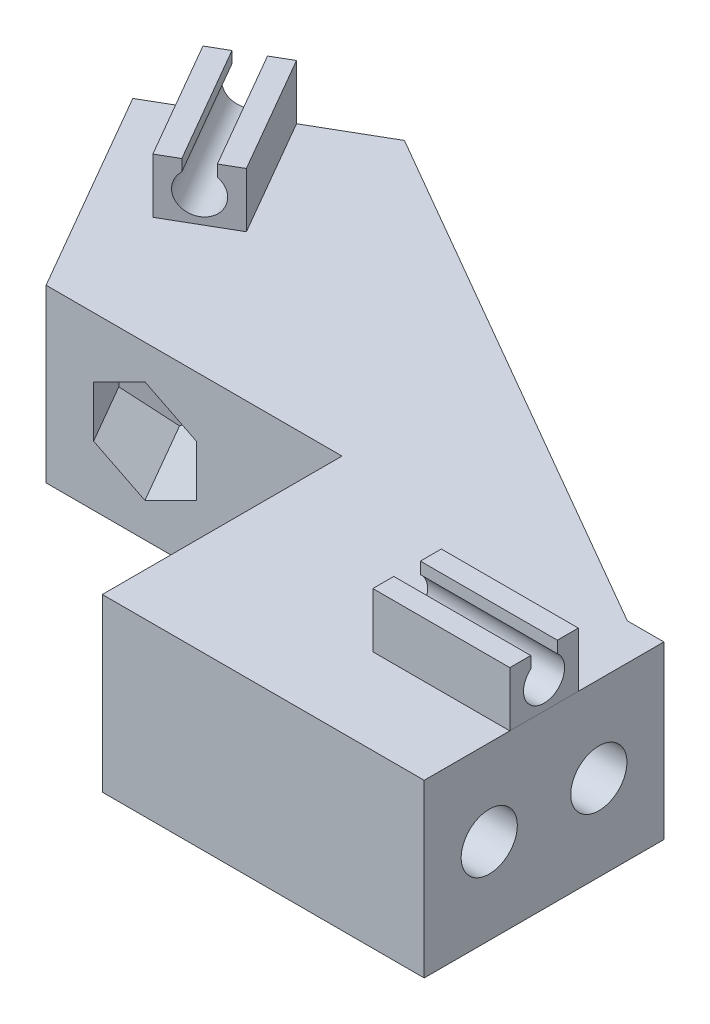
from build123d import *

# Parameters (mm, degrees)
BOSS_EXTRUDE1_DEPTH = 25
SKETCH2_R           = 4.1
CUT_EXTRUDE1_DEPTH  = 132.176713612
SKETCH3_R           = 4.1
CUT_EXTRUDE2_DEPTH  = 126.40868204
CUT_EXTRUDE4_START  = -28
CUT_EXTRUDE4_DEPTH  = 98.40868204
CHAMFER1_SIZE       = 56
CUT_EXTRUDE5_DEPTH  = 103.163428306
BOSS_EXTRUDE2_DEPTH = 20
BOSS_EXTRUDE3_DEPTH = 20


with BuildPart() as part:
    # Sketch1 → Boss-Extrude1 (new body)
    with BuildSketch(Plane(origin=(0, 0, 0), x_dir=(1, 0, 0), z_dir=(0, 1, 0))):
        Polygon((-40.444096004, 58.394853086), (-2.944096004, -6.557052198), (67.055903996, -6.557052198), (67.055903996, 28.442947802), (5.716158034, 28.442947802), (-18.793460909, 70.894853086), align=None)
    extrude(amount=BOSS_EXTRUDE1_DEPTH)

    # Sketch2 → Cut-Extrude1 (cut, through all)
    with BuildSketch(Plane(origin=(67.055903996, 0, 0), x_dir=(0, 0, -1), z_dir=(1, 0, 0))):
        with Locations((2.942947802, 12.5)):
            Circle(SKETCH2_R)
        with Locations((18.942947802, 12.5)):
            Circle(SKETCH2_R)
    extrude(amount=-CUT_EXTRUDE1_DEPTH, mode=Mode.SUBTRACT)

    # Sketch3 → Cut-Extrude2 (cut, through all)
    with BuildSketch(Plane(origin=(-35.396737112, 0, -61.3089471), x_dir=(-0.8660254037844396, 0, 0.4999999999999984), z_dir=(-0.49999999999999833, 0, -0.8660254037844395))):
        with Locations((-6.671811971, 12.5)):
            Circle(SKETCH3_R)
    extrude(amount=-CUT_EXTRUDE2_DEPTH, mode=Mode.SUBTRACT)

    # Sketch5 → Cut-Extrude4 (cut, through all)
    with BuildSketch(Plane(origin=(-35.396737112, 0, -61.3089471), x_dir=(-0.8660254037844397, 0, 0.4999999999999983), z_dir=(-0.4999999999999982, 0, -0.8660254037844396)).offset(CUT_EXTRUDE4_START)):
        Polygon((-13.167002499, 16.25), (-13.167002499, 8.75), (-6.671811971, 5), (-0.176621442, 8.75), (-0.176621442, 16.25), (-6.671811971, 20), align=None)
    extrude(amount=-CUT_EXTRUDE4_DEPTH, mode=Mode.SUBTRACT)

    # Chamfer1
    # the kernel refuses this chamfer: 56 mm, written as the material it adds along each edge
    with BuildSketch(Plane(origin=(5.716158034, 0, -28.442947802), x_dir=(-0.5166440803046883, 0, -0.8562002652920185), z_dir=(0, 1, 0))) as chamfer1_piece_1_section:
        Polygon((CHAMFER1_SIZE * 0.999813220622, -CHAMFER1_SIZE * 0.0193267656127), (-CHAMFER1_SIZE * 0.516644080305, -CHAMFER1_SIZE * 0.856200265292), (0, 0), align=None)
    chamfer1_piece_1 = extrude(amount=25, mode=Mode.PRIVATE)
    chamfer1_piece_1 = split(chamfer1_piece_1, bisect_by=Plane(origin=(-4.727526646, 12.5, -79.015824019), z_dir=(0.49999999999999756, 0, 0.86602540378444)), keep=Keep.TOP, mode=Mode.PRIVATE)
    add(chamfer1_piece_1)

    # Sketch6 → Cut-Extrude5 (cut, through all)
    with BuildSketch(Plane.XZ):
        Polygon((20.055903996, 6.557052198), (20.055903996, -28.442947802), (-23.151355425, -28.442947802), (-2.944096004, 6.557052198), align=None)
    extrude(amount=-CUT_EXTRUDE5_DEPTH, mode=Mode.SUBTRACT)

    # Sketch7 → Boss-Extrude2 (add)
    with BuildSketch(Plane(origin=(-35.396737112, 0, -61.3089471), x_dir=(-0.86602540378444, 0, 0.49999999999999784), z_dir=(-0.49999999999999784, 0, -0.86602540378444))):
        with BuildLine():
            Line((-1.671811971, 33), (-1.671811971, 25))
            Line((-1.671811971, 25), (-11.671811971, 25))
            Line((-11.671811971, 25), (-11.671811971, 33))
            Line((-11.671811971, 33), (-8.571811971, 33))
            Line((-8.571811971, 33), (-8.571811971, 31.321637353))
            ThreePointArc((-8.571811971, 31.321637353), (-6.671811971, 26), (-4.771811971, 31.321637353))
            Line((-4.771811971, 31.321637353), (-4.771811971, 33))
            Line((-4.771811971, 33), (-1.671811971, 33))
        make_face()
    extrude(amount=-BOSS_EXTRUDE2_DEPTH)


with BuildPart() as body_2:
    # Sketch8 → Boss-Extrude3 (new body)
    with BuildSketch(Plane(origin=(67.055903996, 0, 0), x_dir=(0, 0, -1), z_dir=(1, 0, 0))):
        with BuildLine():
            Line((5.942947802, 33), (9.002583557, 33))
            Line((9.002583557, 33), (9.002583557, 31.288009309))
            ThreePointArc((9.002583557, 31.288009309), (10.942947802, 26), (12.883312047, 31.288009309))
            Line((12.883312047, 31.288009309), (12.883312047, 33))
            Line((12.883312047, 33), (15.942947802, 33))
            Line((15.942947802, 33), (15.942947802, 25))
            Line((15.942947802, 25), (5.942947802, 25))
            Line((5.942947802, 25), (5.942947802, 33))
        make_face()
    extrude(amount=-BOSS_EXTRUDE3_DEPTH)


solid = Compound([part.part, body_2.part])
